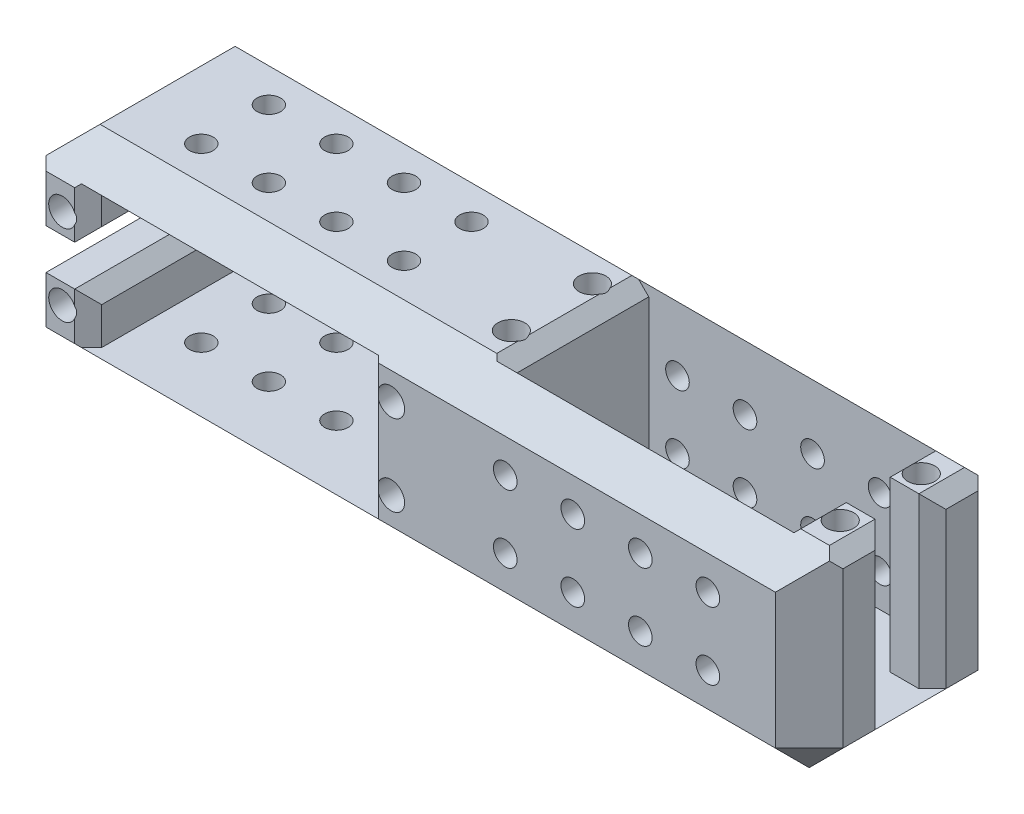
from build123d import *

# Parameters (mm, degrees)
SKETCH1_W           = 57.5
SKETCH1_H           = 30
BOSS_EXTRUDE1_DEPTH = 30
SKETCH2_W           = 41
SKETCH2_H           = 21
CUT_EXTRUDE1_DEPTH  = 25
SKETCH8_R           = 2
CUT_EXTRUDE6_DEPTH  = 10
SKETCH9_W           = 8.25
SKETCH9_H           = 6
CUT_EXTRUDE7_DEPTH  = 25
SKETCH10_R          = 5
CUT_EXTRUDE8_DEPTH  = 10
SKETCH11_W          = 30
SKETCH11_H          = 30
BOSS_EXTRUDE2_DEPTH = 57.5
SKETCH14_R          = 2
CUT_EXTRUDE14_DEPTH = 15
SKETCH18_W          = 41
SKETCH18_H          = 21
SKETCH18_W_2        = 8.25
SKETCH18_H_2        = 6.5
CUT_EXTRUDE15_DEPTH = 25
SKETCH19_R          = 5
CUT_EXTRUDE16_DEPTH = 25
CHAMFER5_SIZE       = 2
SKETCH23_R          = 1.75
CUT_EXTRUDE19_DEPTH = 93.542220094
SKETCH24_R          = 1.75
CUT_EXTRUDE20_DEPTH = 97.120042135
SKETCH26_R          = 7.5
CUT_EXTRUDE21_DEPTH = 2.5
SKETCH27_R          = 7.5
CUT_EXTRUDE22_DEPTH = 2.5


with BuildPart() as part:
    # Sketch1 → Boss-Extrude1 (new body)
    with BuildSketch(Plane.XY):
        Rectangle(SKETCH1_W, SKETCH1_H)
    extrude(amount=BOSS_EXTRUDE1_DEPTH)

    # Sketch2 → Cut-Extrude1 (cut)
    with BuildSketch(Plane.XY.offset(30)):
        Rectangle(SKETCH2_W, SKETCH2_H)
    extrude(amount=-CUT_EXTRUDE1_DEPTH, mode=Mode.SUBTRACT)

    # Sketch8 → Cut-Extrude6 (cut)
    with BuildSketch(Plane.XY.offset(30)):
        with Locations((24.35, 6)):
            Circle(SKETCH8_R)
        with Locations(Location((24.35, -6, 0), (0, 0, 180))):
            Circle(SKETCH8_R)
        with Locations((-24.35, -6)):
            Circle(SKETCH8_R)
        with Locations(Location((-24.35, 6, 0), (0, 0, 180))):
            Circle(SKETCH8_R)
    extrude(amount=-CUT_EXTRUDE6_DEPTH, mode=Mode.SUBTRACT)

    # Sketch9 → Cut-Extrude7 (cut)
    with BuildSketch(Plane.XY.offset(30)):
        with Locations((-24.625, 0)):
            Rectangle(SKETCH9_W, SKETCH9_H)
    extrude(amount=-CUT_EXTRUDE7_DEPTH, mode=Mode.SUBTRACT)

    # Sketch10 → Cut-Extrude8 (cut)
    with BuildSketch(Plane.XY.offset(5)):
        with Locations((-10, 0)):
            Circle(SKETCH10_R)
    extrude(amount=-CUT_EXTRUDE8_DEPTH, mode=Mode.SUBTRACT)

    # Sketch11 → Boss-Extrude2 (add)
    with BuildSketch(Plane(origin=(28.75, 0, 0), x_dir=(0, 0, -1), z_dir=(1, 0, 0))):
        with Locations((-15, 0)):
            Rectangle(SKETCH11_W, SKETCH11_H)
    extrude(amount=BOSS_EXTRUDE2_DEPTH)

    # Sketch14 → Cut-Extrude14 (cut)
    with BuildSketch(Plane(origin=(0, 15, 0), x_dir=(1, 0, 0), z_dir=(0, 1, 0))):
        with Locations(Location((81.85, -9, 0), (0, 0, 270))):
            Circle(SKETCH14_R)
        with Locations(Location((81.85, -21, 0), (0, 0, 90))):
            Circle(SKETCH14_R)
        with Locations(Location((33.15, -21, 0), (0, 0, 270))):
            Circle(SKETCH14_R)
        with Locations(Location((33.15, -9, 0), (0, 0, 90))):
            Circle(SKETCH14_R)
    extrude(amount=-CUT_EXTRUDE14_DEPTH, mode=Mode.SUBTRACT)

    # Sketch18 → Cut-Extrude15 (cut)
    with BuildSketch(Plane(origin=(0, 15, 0), x_dir=(1, 0, 0), z_dir=(0, 1, 0))):
        with Locations((57.5, -15)):
            Rectangle(SKETCH18_W, SKETCH18_H)
        with Locations((82.125, -15)):
            Rectangle(SKETCH18_W_2, SKETCH18_H_2)
    extrude(amount=-CUT_EXTRUDE15_DEPTH, mode=Mode.SUBTRACT)

    # Sketch19 → Cut-Extrude16 (cut)
    with BuildSketch(Plane.XZ.offset(15)):
        with Locations(Location((67.5, 15, 0), (0, 0, 270))):
            Circle(SKETCH19_R)
    extrude(amount=-CUT_EXTRUDE16_DEPTH, mode=Mode.SUBTRACT)

    # Chamfer4
    # the kernel refuses this chamfer: 5 mm, written as the material it takes off along each edge
    with BuildSketch(Plane(origin=(-25.416666667, -11.666666667, 3.333333333), x_dir=(-0.7071067811865475, 0.7071067811865477, 0), z_dir=(-0.5773502691896258, -0.5773502691896257, -0.5773502691896257)), Plane(origin=(82.916666667, -11.666666667, 3.333333333), x_dir=(0, 0.707106781186547, -0.707106781186548), z_dir=(0.577350269189626, -0.5773502691896262, -0.5773502691896253)), Plane(origin=(-25.416666667, 11.666666667, 3.333333333), x_dir=(0, -0.7071067811865475, -0.7071067811865475), z_dir=(-0.5773502691896257, 0.5773502691896257, -0.5773502691896257))) as chamfer4_piece_1:
        Polygon((-3.535533906, -2.041241452), (3.535533906, -2.041241452), (0, 4.082482905), align=None)
    extrude(amount=6.350852961, mode=Mode.SUBTRACT)
    with BuildSketch(Plane(origin=(82.916666667, -11.666666667, 26.666666667), x_dir=(0, 0.7071067811865474, 0.7071067811865476), z_dir=(0.5773502691896257, -0.5773502691896258, 0.5773502691896257))) as chamfer4_piece_2:
        Polygon((-3.535533906, 2.041241452), (3.535533906, 2.041241452), (0, -4.082482905), align=None)
    extrude(amount=6.350852961, mode=Mode.SUBTRACT)
    with BuildSketch(Plane(origin=(-41.60841494, -15, 0), x_dir=(0, -0.027495876610586317, 0.9996219169112968), z_dir=(1, 0, 0)), Plane(origin=(99.10841494, -15, 30), x_dir=(0, -0.027495876610586317, -0.9996219169112968), z_dir=(-1, 0, 0)), Plane(origin=(99.10841494, 15, 30), x_dir=(0, -0.9996219169112968, 0.027495876610586317), z_dir=(-1, 0, 0)), Plane(origin=(-41.60841494, 15, 0), x_dir=(0, -0.9996219169112968, -0.027495876610586372), z_dir=(1, 0, 0))) as chamfer4_piece_3:
        with BuildLine():
            Line((5.143365976, 0), (-0.282735774, -5.135588968))
            Line((-0.282735774, -5.135588968), (-0.382697966, -5.13283938))
            ThreePointArc((-0.382697966, -5.13283938), (-0.170646135, -2.566989148), (-0.099962192, 0.002749588))
            Line((-0.099962192, 0.002749588), (0.002749588, 0.099962192))
            ThreePointArc((0.002749588, 0.099962192), (2.572488324, 0.029278248), (5.146115564, 0.099962192))
            Line((5.146115564, 0.099962192), (5.143365976, 0))
        make_face()
    extrude(amount=140.71682988, mode=Mode.SUBTRACT)
    with BuildSketch(Plane(origin=(86.25, 27.85841494, 30), x_dir=(-0.9996219169112968, 0, 0.027495876610586282), z_dir=(0, -1, 0)), Plane(origin=(86.25, -15, 42.85841494), x_dir=(-0.9996219169112968, -0.027495876610586282, 0), z_dir=(0, 0, -1)), Plane(origin=(86.25, -27.85841494, 0), x_dir=(-0.9996219169112968, 0, -0.027495876610586334), z_dir=(0, 1, 0)), Plane(origin=(-28.75, 15, -12.85841494), x_dir=(-0.027495876610586317, -0.9996219169112968, 0), z_dir=(0, 0, 1)), Plane(origin=(-28.75, -15, -12.85841494), x_dir=(0.9996219169112968, -0.027495876610586317, 0), z_dir=(0, 0, 1))) as chamfer4_piece_4:
        with BuildLine():
            Line((5.143365976, 0), (-0.282735774, 5.135588968))
            Line((-0.282735774, 5.135588968), (-0.382697966, 5.13283938))
            ThreePointArc((-0.382697966, 5.13283938), (-0.170646135, 2.566989148), (-0.099962192, -0.002749588))
            Line((-0.099962192, -0.002749588), (0.002749588, -0.099962192))
            ThreePointArc((0.002749588, -0.099962192), (2.572488324, -0.029278248), (5.146115564, -0.099962192))
            Line((5.146115564, -0.099962192), (5.143365976, 0))
        make_face()
    extrude(amount=55.71682988, mode=Mode.SUBTRACT)
    with BuildSketch(Plane(origin=(-28.75, 27.85841494, 0), x_dir=(-0.027495876610586317, 0, 0.9996219169112968), z_dir=(0, -1, 0))) as chamfer4_piece_5:
        with BuildLine():
            Line((5.143365976, 0), (-0.282735774, -5.135588968))
            Line((-0.282735774, -5.135588968), (-0.382697966, -5.13283938))
            ThreePointArc((-0.382697966, -5.13283938), (-0.170646135, -2.566989148), (-0.099962192, 0.002749588))
            Line((-0.099962192, 0.002749588), (0.002749588, 0.099962192))
            ThreePointArc((0.002749588, 0.099962192), (2.572488324, 0.029278248), (5.146115564, 0.099962192))
            Line((5.146115564, 0.099962192), (5.143365976, 0))
        make_face()
    extrude(amount=55.71682988, mode=Mode.SUBTRACT)

    # Chamfer5
    # the kernel refuses this chamfer: 2 mm, written as the material it takes off along each edge
    with BuildSketch(Plane(origin=(78, 15, 16.893365976), x_dir=(-0.02749587661058907, -0.9996219169112965, 0), z_dir=(0, 0, -1))) as chamfer5_piece_1_section:
        Polygon((CHAMFER5_SIZE * 0.999621916911, -CHAMFER5_SIZE * 0.0274958766106), (-CHAMFER5_SIZE * 0.0274958766106, -CHAMFER5_SIZE * 0.999621916911), (0, 0), align=None)
    chamfer5_piece_1 = extrude(amount=17.036731952, mode=Mode.PRIVATE)
    chamfer5_piece_1 = split(chamfer5_piece_1, bisect_by=Plane(origin=(78.661782126, 14.324773972, 4.5), z_dir=(0, 0, 1)), keep=Keep.TOP, mode=Mode.PRIVATE)
    add(chamfer5_piece_1, mode=Mode.SUBTRACT)
    with BuildSketch(Plane(origin=(78, 20.143365976, 11.75), x_dir=(-0.02749587661058907, 0, -0.9996219169112965), z_dir=(0, -1, 0)), Plane(origin=(78, 20.143365976, 18.25), x_dir=(0.9996219169112968, 0, -0.02749587661058555), z_dir=(0, -1, 0)), Plane(origin=(86.25, 20.143365976, 18.25), x_dir=(0.0274958766105891, 0, 0.9996219169112968), z_dir=(0, -1, 0)), Plane(origin=(-20.5, -3, 35.143365976), x_dir=(0.027495876610585623, -0.9996219169112968, 0), z_dir=(0, 0, -1)), Plane(origin=(-28.75, 3, 35.143365976), x_dir=(-0.027495876610585623, 0.9996219169112968, 0), z_dir=(0, 0, -1))) as chamfer5_piece_2:
        Polygon((CHAMFER5_SIZE * 0.999621916911, CHAMFER5_SIZE * 0.0274958766106), (-CHAMFER5_SIZE * 0.0274958766106, CHAMFER5_SIZE * 0.999621916911), (0, 0), align=None)
    extrude(amount=30.143365976, mode=Mode.SUBTRACT)
    with BuildSketch(Plane(origin=(86.25, 15, -0.143365976), x_dir=(0.02749587661058907, -0.9996219169112965, 0), z_dir=(0, 0, 1)), Plane(origin=(86.25, 15, 13.106634024), x_dir=(0.02749587661058907, -0.9996219169112965, 0), z_dir=(0, 0, 1))) as chamfer5_piece_3:
        Polygon((CHAMFER5_SIZE * 0.999621916911, -CHAMFER5_SIZE * 0.0274958766106), (-CHAMFER5_SIZE * 0.0274958766106, -CHAMFER5_SIZE * 0.999621916911), (0, 0), align=None)
    extrude(amount=17.036731952, mode=Mode.SUBTRACT)
    with BuildSketch(Plane(origin=(86.25, 20.143365976, 11.75), x_dir=(0.02749587661058907, 0, -0.9996219169112965), z_dir=(0, -1, 0)), Plane(origin=(-28.75, -3, 35.143365976), x_dir=(-0.027495876610585623, -0.9996219169112968, 0), z_dir=(0, 0, -1)), Plane(origin=(-20.5, 3, 35.143365976), x_dir=(0.027495876610585623, 0.9996219169112968, 0), z_dir=(0, 0, -1))) as chamfer5_piece_4:
        Polygon((CHAMFER5_SIZE * 0.999621916911, -CHAMFER5_SIZE * 0.0274958766106), (-CHAMFER5_SIZE * 0.0274958766106, -CHAMFER5_SIZE * 0.999621916911), (0, 0), align=None)
    extrude(amount=30.143365976, mode=Mode.SUBTRACT)
    with BuildSketch(Plane(origin=(78, 15, 30.143365976), x_dir=(0.9996219169112968, 0.027495876610586414, 0), z_dir=(0, 0, -1))) as chamfer5_piece_5_section:
        Polygon((CHAMFER5_SIZE * 0.999621916911, CHAMFER5_SIZE * 0.0274958766106), (-CHAMFER5_SIZE * 0.0274958766106, CHAMFER5_SIZE * 0.999621916911), (0, 0), align=None)
    chamfer5_piece_5 = extrude(amount=17.036731952, mode=Mode.PRIVATE)
    chamfer5_piece_5 = split(chamfer5_piece_5, bisect_by=Plane(origin=(78.661782126, 14.324773972, 25.5), z_dir=(0, 0, -1)), keep=Keep.TOP, mode=Mode.PRIVATE)
    add(chamfer5_piece_5, mode=Mode.SUBTRACT)
    with BuildSketch(Plane(origin=(-28.75, 2.143365976, 30), x_dir=(0.9996219169112968, 0, 0.027495876610585647), z_dir=(0, -1, 0))) as chamfer5_piece_6:
        Polygon((CHAMFER5_SIZE * 0.999621916911, -CHAMFER5_SIZE * 0.0274958766106), (-CHAMFER5_SIZE * 0.0274958766106, -CHAMFER5_SIZE * 0.999621916911), (0, 0), align=None)
    extrude(amount=17.286731952, mode=Mode.SUBTRACT)
    with BuildSketch(Plane(origin=(-20.5, 2.143365976, 30), x_dir=(0.027495876610585647, 0, -0.9996219169112968), z_dir=(0, -1, 0))) as chamfer5_piece_7_section:
        Polygon((CHAMFER5_SIZE * 0.999621916911, -CHAMFER5_SIZE * 0.0274958766106), (-CHAMFER5_SIZE * 0.0274958766106, -CHAMFER5_SIZE * 0.999621916911), (0, 0), align=None)
    chamfer5_piece_7 = extrude(amount=17.286731952, mode=Mode.PRIVATE)
    chamfer5_piece_7 = split(chamfer5_piece_7, bisect_by=Plane(origin=(-21.161947574, -10.5, 29.325063892), z_dir=(0, 1, 0)), keep=Keep.TOP, mode=Mode.PRIVATE)
    add(chamfer5_piece_7, mode=Mode.SUBTRACT)
    with BuildSketch(Plane(origin=(-28.75, 15.143365976, 30), x_dir=(-0.027495876610585647, 0, -0.9996219169112968), z_dir=(0, -1, 0))) as chamfer5_piece_8:
        Polygon((CHAMFER5_SIZE * 0.999621916911, CHAMFER5_SIZE * 0.0274958766106), (-CHAMFER5_SIZE * 0.0274958766106, CHAMFER5_SIZE * 0.999621916911), (0, 0), align=None)
    extrude(amount=17.286731952, mode=Mode.SUBTRACT)
    with BuildSketch(Plane(origin=(-20.5, 15.143365976, 30), x_dir=(-0.9996219169112968, 0, 0.027495876610585647), z_dir=(0, -1, 0))) as chamfer5_piece_9_section:
        Polygon((CHAMFER5_SIZE * 0.999621916911, CHAMFER5_SIZE * 0.0274958766106), (-CHAMFER5_SIZE * 0.0274958766106, CHAMFER5_SIZE * 0.999621916911), (0, 0), align=None)
    chamfer5_piece_9 = extrude(amount=17.286731952, mode=Mode.PRIVATE)
    chamfer5_piece_9 = split(chamfer5_piece_9, bisect_by=Plane(origin=(-21.161947574, 10.5, 29.325063892), z_dir=(0, -1, 0)), keep=Keep.TOP, mode=Mode.PRIVATE)
    add(chamfer5_piece_9, mode=Mode.SUBTRACT)
    with BuildSketch(Plane(origin=(20.5, -15.143365976, 30), x_dir=(0.9996219169112968, 0, 0.027495876610585647), z_dir=(0, 1, 0))) as chamfer5_piece_10_section:
        Polygon((CHAMFER5_SIZE * 0.999621916911, CHAMFER5_SIZE * 0.0274958766106), (-CHAMFER5_SIZE * 0.0274958766106, CHAMFER5_SIZE * 0.999621916911), (0, 0), align=None)
    chamfer5_piece_10 = extrude(amount=30.286731952, mode=Mode.PRIVATE)
    chamfer5_piece_10 = split(chamfer5_piece_10, bisect_by=Plane(origin=(21.163311367, -10.5, 29.327453718), z_dir=(0, 1, 0)), keep=Keep.TOP, mode=Mode.PRIVATE)
    chamfer5_piece_10 = split(chamfer5_piece_10, bisect_by=Plane(origin=(21.163311367, 10.5, 29.327453718), z_dir=(0, -1, 0)), keep=Keep.TOP, mode=Mode.PRIVATE)
    add(chamfer5_piece_10, mode=Mode.SUBTRACT)
    with BuildSketch(Plane(origin=(37, 15, -0.143365976), x_dir=(0.027495876610585623, -0.9996219169112968, 0), z_dir=(0, 0, 1))) as chamfer5_piece_11_section:
        Polygon((CHAMFER5_SIZE * 0.999621916911, -CHAMFER5_SIZE * 0.0274958766106), (-CHAMFER5_SIZE * 0.0274958766106, -CHAMFER5_SIZE * 0.999621916911), (0, 0), align=None)
    chamfer5_piece_11 = extrude(amount=30.286731952, mode=Mode.PRIVATE)
    chamfer5_piece_11 = split(chamfer5_piece_11, bisect_by=Plane(origin=(36.336688633, 14.327453718, 25.5), z_dir=(0, 0, -1)), keep=Keep.TOP, mode=Mode.PRIVATE)
    chamfer5_piece_11 = split(chamfer5_piece_11, bisect_by=Plane(origin=(36.336688633, 14.327453718, 4.5), z_dir=(0, 0, 1)), keep=Keep.TOP, mode=Mode.PRIVATE)
    add(chamfer5_piece_11, mode=Mode.SUBTRACT)

    # Sketch23 → Cut-Extrude19 (cut, through all)
    with BuildSketch(Plane.XY.offset(30)):
        with Locations((71.25, 5)):
            Circle(SKETCH23_R)
        with Locations((71.25, -5)):
            Circle(SKETCH23_R)
        with Locations((61.25, 5)):
            Circle(SKETCH23_R)
        with Locations((61.25, -5)):
            Circle(SKETCH23_R)
        with Locations((51.25, 5)):
            Circle(SKETCH23_R)
        with Locations((51.25, -5)):
            Circle(SKETCH23_R)
        with Locations((41.25, 5)):
            Circle(SKETCH23_R)
        with Locations((41.25, -5)):
            Circle(SKETCH23_R)
    extrude(amount=-CUT_EXTRUDE19_DEPTH, mode=Mode.SUBTRACT)

    # Sketch24 → Cut-Extrude20 (cut, through all)
    with BuildSketch(Plane(origin=(0, 15, 0), x_dir=(1, 0, 0), z_dir=(0, 1, 0))):
        with Locations(Location((-13.75, -10, 0), (0, 0, 270))):
            Circle(SKETCH24_R)
        with Locations(Location((-13.75, -20, 0), (0, 0, 270))):
            Circle(SKETCH24_R)
        with Locations(Location((-3.75, -10, 0), (0, 0, 270))):
            Circle(SKETCH24_R)
        with Locations(Location((-3.75, -20, 0), (0, 0, 270))):
            Circle(SKETCH24_R)
        with Locations(Location((6.25, -10, 0), (0, 0, 270))):
            Circle(SKETCH24_R)
        with Locations(Location((6.25, -20, 0), (0, 0, 270))):
            Circle(SKETCH24_R)
        with Locations(Location((16.25, -10, 0), (0, 0, 270))):
            Circle(SKETCH24_R)
        with Locations(Location((16.25, -20, 0), (0, 0, 270))):
            Circle(SKETCH24_R)
    extrude(amount=-CUT_EXTRUDE20_DEPTH, mode=Mode.SUBTRACT)

    # Sketch26 → Cut-Extrude21 (cut)
    with BuildSketch(Plane.XY.offset(5)):
        with Locations((-10, 0)):
            Circle(SKETCH26_R)
    extrude(amount=-CUT_EXTRUDE21_DEPTH, mode=Mode.SUBTRACT)

    # Sketch27 → Cut-Extrude22 (cut)
    with BuildSketch(Plane(origin=(0, -10, 0), x_dir=(1, 0, 0), z_dir=(0, 1, 0))):
        with Locations(Location((67.5, -15, 0), (0, 0, 270))):
            Circle(SKETCH27_R)
    extrude(amount=-CUT_EXTRUDE22_DEPTH, mode=Mode.SUBTRACT)


solid = part.part
